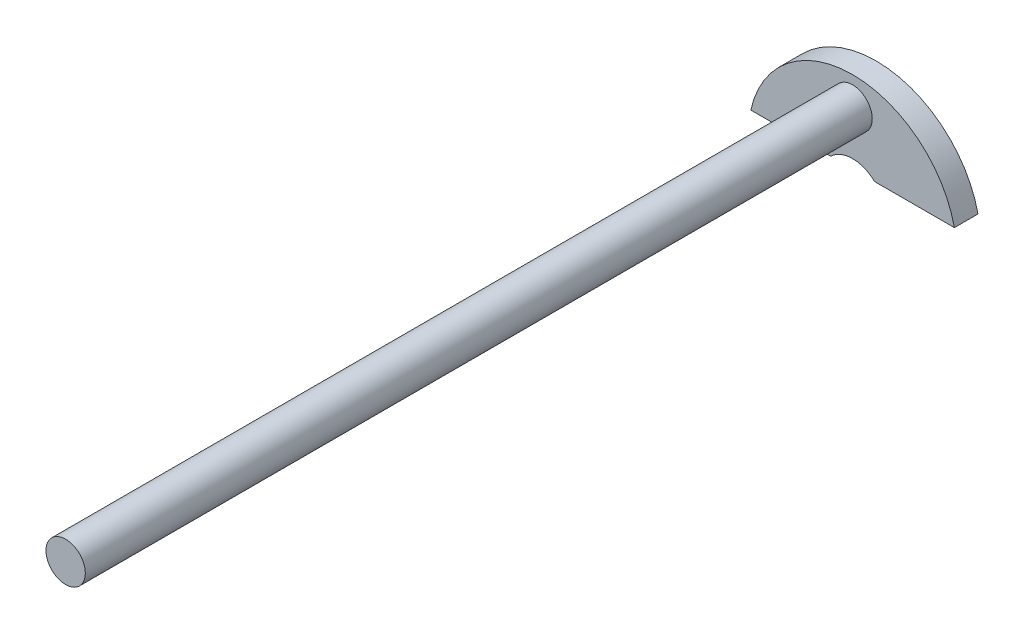
from build123d import *

# Parameters (mm, degrees)
BASEPLATE_DEPTH = 3
SKETCH5_R       = 2.5
ROD_DEPTH       = 100


with BuildPart() as part:
    # Sketch3 → BasePlate (new body)
    with BuildSketch(Plane.XY):
        with BuildLine():
            ThreePointArc((12.935271733, 2.870756902), (0, 13.25), (-12.935271733, 2.870756902))
            Line((-12.935271733, 2.870756902), (-2.785454148, 2.870756902))
            ThreePointArc((-2.785454148, 2.870756902), (0, 4), (2.785454148, 2.870756902))
            Line((2.785454148, 2.870756902), (12.935271733, 2.870756902))
        make_face()
    extrude(amount=BASEPLATE_DEPTH)

    # Sketch5 → Rod (add)
    with BuildSketch(Plane.XY.offset(3)):
        with Locations((0, 9.620756902)):
            Circle(SKETCH5_R)
    extrude(amount=ROD_DEPTH)


solid = part.part
